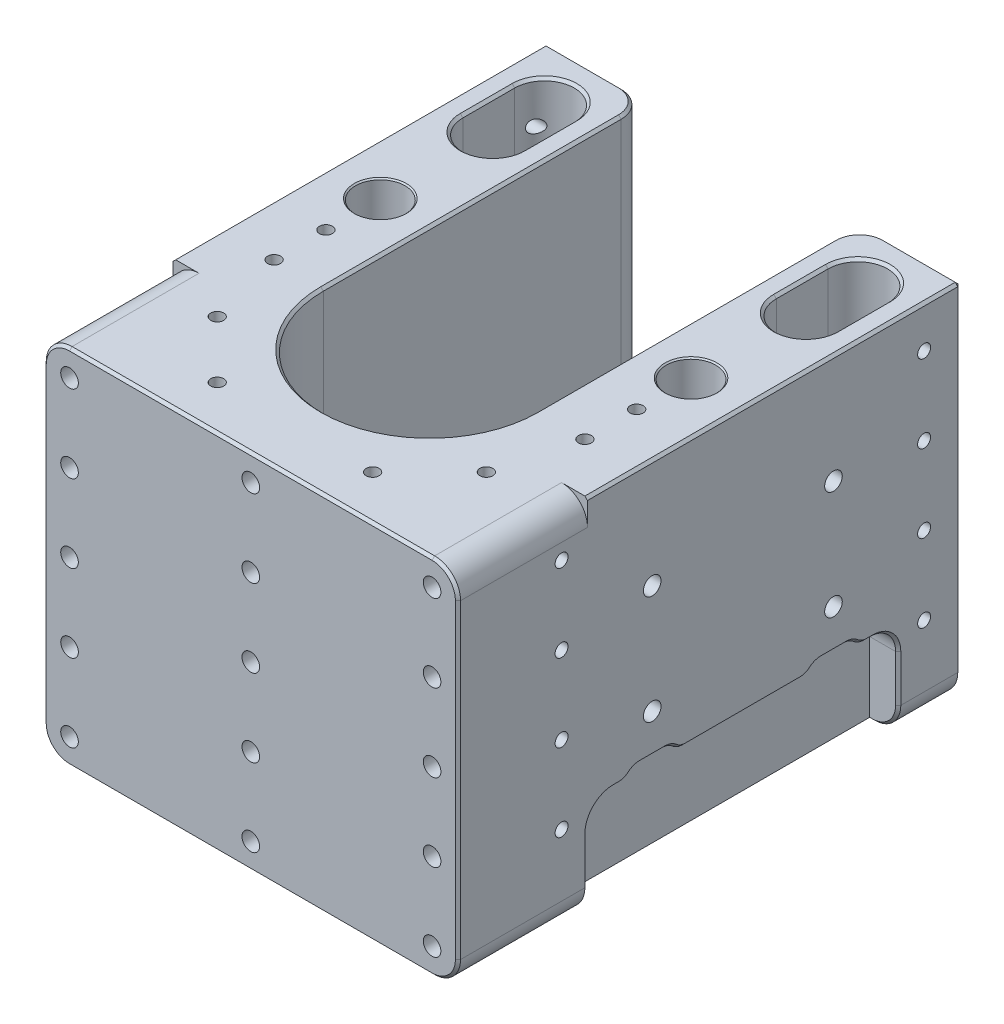
from build123d import *

# Parameters (mm, degrees)
BOSS_EXTRUDE1_DEPTH              = 140
SKETCH3_R                        = 9.55
CUT_EXTRUDE2_DEPTH               = 14.326
M8X1_25_TAPPED_HOLE1_AT_2_COUNT  = 2
M8X1_25_TAPPED_HOLE1_AT_2_PITCH  = 70
M8X1_25_TAPPED_HOLE1_AT_3_COUNT  = 2
M8X1_25_TAPPED_HOLE1_AT_3_PITCH  = 81.633326528
M8X1_25_TAPPED_HOLE1_AT_4_COUNT  = 2
M8X1_25_TAPPED_HOLE1_AT_4_PITCH  = 42
FILLET1_R                        = 10
SKETCH36_W                       = 33.761991249
SKETCH36_H                       = 120
SKETCH36_W_2                     = 53.52949171
CUT_EXTRUDE3_DEPTH               = 38
CBORE_FOR_M8_SHCS1_D             = 9
CBORE_FOR_M8_SHCS1_CBORE_D       = 15
CBORE_FOR_M8_SHCS1_CBORE_DEPTH   = 9
CHAMFER7_SIZE                    = 0.5
CHAMFER11_SIZE                   = 1
CHAMFER12_SIZE                   = 0.5
M8X1_25_TAPPED_HOLE3_D           = 6.8
M8X1_25_TAPPED_HOLE3_DEPTH       = 20
M8X1_25_TAPPED_HOLE3_CSINK_D     = 8.6
M8X1_25_TAPPED_HOLE3_CSINK_ANGLE = 90
M8X1_25_TAPPED_HOLE3_TIP         = 2.042926105
M6X1_0_TAPPED_HOLE1_D            = 5
M6X1_0_TAPPED_HOLE1_DEPTH        = 15
M6X1_0_TAPPED_HOLE1_CSINK_D      = 6.05
M6X1_0_TAPPED_HOLE1_CSINK_ANGLE  = 90
M6X1_0_TAPPED_HOLE1_TIP          = 1.502151548
CUT_EXTRUDE4_DEPTH               = 25
FILLET2_R                        = 10
CUT_EXTRUDE5_DEPTH               = 50
FILLET3_R                        = 10
CHAMFER3_SIZE                    = 1
CHAMFER15_SIZE                   = 1
SKETCH55_W                       = 20
SKETCH55_H                       = 3
CUT_EXTRUDE6_DEPTH               = 227.296265988
FILLET4_R                        = 6
FILLET5_R                        = 6
CHAMFER16_SIZE                   = 1
M8X1_25_TAPPED_HOLE4_D           = 6.8
M8X1_25_TAPPED_HOLE4_DEPTH       = 20
M8X1_25_TAPPED_HOLE4_TIP         = 2.042926105
M6X1_0_TAPPED_HOLE2_D            = 5
M6X1_0_TAPPED_HOLE2_DEPTH        = 17
M6X1_0_TAPPED_HOLE2_TIP          = 1.502151548
M6X1_0_TAPPED_HOLE3_AT_2_COUNT   = 2
M6X1_0_TAPPED_HOLE3_AT_2_PITCH   = 30
M6X1_0_TAPPED_HOLE3_AT_3_COUNT   = 2
M6X1_0_TAPPED_HOLE3_AT_3_PITCH   = 60
M6X1_0_TAPPED_HOLE3_AT_4_COUNT   = 2
M6X1_0_TAPPED_HOLE3_AT_4_PITCH   = 90
M6X1_0_TAPPED_HOLE3_AT_5_COUNT   = 2
M6X1_0_TAPPED_HOLE3_AT_5_PITCH   = 140
M6X1_0_TAPPED_HOLE3_AT_6_COUNT   = 2
M6X1_0_TAPPED_HOLE3_AT_6_PITCH   = 143.178210633
M6X1_0_TAPPED_HOLE3_AT_7_COUNT   = 2
M6X1_0_TAPPED_HOLE3_AT_7_PITCH   = 152.315462117
M6X1_0_TAPPED_HOLE3_AT_8_COUNT   = 2
M6X1_0_TAPPED_HOLE3_AT_8_PITCH   = 166.433169771


with BuildPart() as part:
    # Sketch1 → Boss-Extrude1 (new body)
    with BuildSketch(Plane(origin=(0, 0, 0), x_dir=(1, 0, 0), z_dir=(0, 1, 0))):
        with BuildLine():
            Line((41, 97), (80, 97))
            Line((80, 97), (80, -97))
            Line((80, -97), (-80, -97))
            Line((-80, -97), (-80, 97))
            Line((-80, 97), (-41, 97))
            Line((-41, 97), (-41, -28))
            ThreePointArc((-41, -28), (0, -69), (41, -28))
            Line((41, -28), (41, 97))
        make_face()
    extrude(amount=BOSS_EXTRUDE1_DEPTH)

    # Sketch3 → Cut-Extrude2 (cut)
    with BuildSketch(Plane(origin=(0, 140, 0), x_dir=(1, 0, 0), z_dir=(0, 1, 0))):
        with Locations(Location((-60, 13, 0), (0, 0, 270))):
            Circle(SKETCH3_R)
        with Locations(Location((60, 13, 0), (0, 0, 270))):
            Circle(SKETCH3_R)
    extrude(amount=-CUT_EXTRUDE2_DEPTH, mode=Mode.SUBTRACT)

    # Sketch10 → M8x1.25 Tapped Hole1 (revolve, cut)
    with BuildSketch(Plane(origin=(80, 56, -48), x_dir=(0, 0, -1), z_dir=(0, 1, 0))):
        Polygon((0, 0), (0, 32.042926105), (3.4, 30), (3.4, 0), align=None)
    m8x1_25_tapped_hole1 = revolve(axis=Axis((86.35, 56, -48), (-1, 0, 0)), mode=Mode.SUBTRACT)

    # M8x1.25 Tapped Hole1 at 2: M8x1.25 Tapped Hole1 ×2
    with Locations(*[(0, 0, i * M8X1_25_TAPPED_HOLE1_AT_2_PITCH) for i in range(1, M8X1_25_TAPPED_HOLE1_AT_2_COUNT)]):
        add(m8x1_25_tapped_hole1, mode=Mode.SUBTRACT)

    # M8x1.25 Tapped Hole1 at 3: M8x1.25 Tapped Hole1 ×2
    with Locations(*[Vector(0, 0.5144957554275263, 0.8574929257125443) * (i * M8X1_25_TAPPED_HOLE1_AT_3_PITCH) for i in range(1, M8X1_25_TAPPED_HOLE1_AT_3_COUNT)]):
        add(m8x1_25_tapped_hole1, mode=Mode.SUBTRACT)

    # M8x1.25 Tapped Hole1 at 4: M8x1.25 Tapped Hole1 ×2
    with Locations(*[(0, i * M8X1_25_TAPPED_HOLE1_AT_4_PITCH, 0) for i in range(1, M8X1_25_TAPPED_HOLE1_AT_4_COUNT)]):
        add(m8x1_25_tapped_hole1, mode=Mode.SUBTRACT)

    # Mirror2: M8x1.25 Tapped Hole1 across plane
    add(m8x1_25_tapped_hole1.mirror(Plane(origin=(0, 0, 0), x_dir=(0, 0, 1), z_dir=(1, 0, 0))), mode=Mode.SUBTRACT)

    # Mirror2 copy 1 sketch → Mirror2 copy 1 (revolve, cut)
    with BuildSketch(Plane(origin=(-80, 56, 22), x_dir=(0, 0, -1), z_dir=(0, 1, 0))):
        Polygon((0, 0), (0, -32.042926105), (3.4, -30), (3.4, 0), align=None)
    revolve(axis=Axis((-86.35, 56, 22), (-1, 0, 0)), mode=Mode.SUBTRACT)

    # Mirror2 copy 2 sketch → Mirror2 copy 2 (revolve, cut)
    with BuildSketch(Plane(origin=(-80, 98, 22), x_dir=(0, 0, -1), z_dir=(0, 1, 0))):
        Polygon((0, 0), (0, -32.042926105), (3.4, -30), (3.4, 0), align=None)
    revolve(axis=Axis((-86.35, 98, 22), (-1, 0, 0)), mode=Mode.SUBTRACT)

    # Mirror2 copy 3 sketch → Mirror2 copy 3 (revolve, cut)
    with BuildSketch(Plane(origin=(-80, 98, -48), x_dir=(0, 0, -1), z_dir=(0, 1, 0))):
        Polygon((0, 0), (0, -32.042926105), (3.4, -30), (3.4, 0), align=None)
    revolve(axis=Axis((-86.35, 98, -48), (-1, 0, 0)), mode=Mode.SUBTRACT)

    # Fillet1
    fillet1_edges = [part.edges().sort_by_distance(p)[0] for p in [
        (-41, 70, -97),
        (41, 70, -97),
    ]]
    fillet(fillet1_edges, radius=FILLET1_R)

    # Sketch36 → Cut-Extrude3 (cut)
    with BuildSketch(Plane(origin=(0, 0, 0), x_dir=(1, 0, 0), z_dir=(0, 1, 0))):
        with Locations((-85.880995625, 13)):
            Rectangle(SKETCH36_W, SKETCH36_H)
        with Locations((95.764745855, 13)):
            Rectangle(SKETCH36_W_2, SKETCH36_H)
    extrude(amount=CUT_EXTRUDE3_DEPTH, mode=Mode.SUBTRACT)

    # CBORE for M8 SHCS1 (through all)
    with Locations(Plane(origin=(0, 0, 0), x_dir=(-1, 0, 0), z_dir=(0, -1, 0))):
        with Locations((60, 13), (-60, 13)):
            CounterBoreHole(CBORE_FOR_M8_SHCS1_D / 2, CBORE_FOR_M8_SHCS1_CBORE_D / 2, CBORE_FOR_M8_SHCS1_CBORE_DEPTH)

    # Chamfer7
    chamfer7_edges = [part.edges().sort_by_distance(p)[0] for p in [
        (-60, 140, -22.55),
        (60, 140, -22.55),
    ]]
    chamfer(chamfer7_edges, length=CHAMFER7_SIZE)

    # Chamfer11
    chamfer11_edges = [part.edges().sort_by_distance(p)[0] for p in [
        (67.5, 0, -13),
        (-52.5, 0, -13),
    ]]
    chamfer(chamfer11_edges, length=CHAMFER11_SIZE)

    # Chamfer12
    chamfer12_edges = [part.edges().sort_by_distance(p)[0] for p in [
        (55.5, 125.674, -13),
        (55.5, 9, -13),
        (-64.5, 125.674, -13),
        (-64.5, 9, -13),
    ]]
    chamfer(chamfer12_edges, length=CHAMFER12_SIZE)

    # M8x1.25 Tapped Hole3
    with Locations(Plane(origin=(0, 0, 0), x_dir=(-1, 0, 0), z_dir=(0, -1, 0))):
        with Locations((54, 57.5), (54, 27.5), (54, -2.5), (54, -32.5), (-54, 57.5), (-54, 27.5), (-54, -2.5), (-54, -32.5), (-54, -62.5), (54, -62.5)):
            CounterSinkHole(M8X1_25_TAPPED_HOLE3_D / 2, M8X1_25_TAPPED_HOLE3_CSINK_D / 2, depth=M8X1_25_TAPPED_HOLE3_DEPTH, counter_sink_angle=M8X1_25_TAPPED_HOLE3_CSINK_ANGLE)
            with Locations((0, 0, -(M8X1_25_TAPPED_HOLE3_DEPTH + M8X1_25_TAPPED_HOLE3_TIP / 2))):  # 118° drill point
                Cone(0, M8X1_25_TAPPED_HOLE3_D / 2, M8X1_25_TAPPED_HOLE3_TIP, mode=Mode.SUBTRACT)

    # M6x1.0 Tapped Hole1
    with Locations(Plane(origin=(0, 0, 0), x_dir=(-1, 0, 0), z_dir=(0, -1, 0))):
        with Locations((-60, -85), (-20, -85), (20, -85), (60, -85)):
            CounterSinkHole(M6X1_0_TAPPED_HOLE1_D / 2, M6X1_0_TAPPED_HOLE1_CSINK_D / 2, depth=M6X1_0_TAPPED_HOLE1_DEPTH, counter_sink_angle=M6X1_0_TAPPED_HOLE1_CSINK_ANGLE)
            with Locations((0, 0, -(M6X1_0_TAPPED_HOLE1_DEPTH + M6X1_0_TAPPED_HOLE1_TIP / 2))):  # 118° drill point
                Cone(0, M6X1_0_TAPPED_HOLE1_D / 2, M6X1_0_TAPPED_HOLE1_TIP, mode=Mode.SUBTRACT)

    # Sketch45 → Cut-Extrude4 (cut)
    with BuildSketch(Plane(origin=(0, 140, 0), x_dir=(1, 0, 0), z_dir=(0, 1, 0))):
        with BuildLine():
            Line((-72, 56.905108067), (-72, 76.905108067))
            ThreePointArc((-72, 76.905108067), (-60.5, 88.405108067), (-49, 76.905108067))
            Line((-49, 76.905108067), (-49, 56.905108067))
            ThreePointArc((-49, 56.905108067), (-60.5, 45.405108067), (-72, 56.905108067))
        make_face()
    cut_extrude4 = extrude(amount=-CUT_EXTRUDE4_DEPTH, mode=Mode.SUBTRACT)

    # Mirror3: Cut-Extrude4 across plane
    add(cut_extrude4.mirror(Plane(origin=(0, 0, 0), x_dir=(0, 0, 1), z_dir=(1, 0, 0))), mode=Mode.SUBTRACT)

    # Fillet2
    fillet2_edges = [part.edges().sort_by_distance(p)[0] for p in [
        (74.5, 38, -73),
        (74.5, 38, 47),
        (-74.5, 38, -73),
        (-74.5, 38, 47),
    ]]
    fillet(fillet2_edges, radius=FILLET2_R)

    # Sketch46 → Cut-Extrude5 (cut)
    with BuildSketch(Plane.XY.offset(97)):
        with BuildLine():
            Line((70, 140), (80, 140))
            Line((80, 140), (80, 130))
            ThreePointArc((80, 130), (77.071067812, 137.071067812), (70, 140))
        make_face()
    cut_extrude5 = extrude(amount=-CUT_EXTRUDE5_DEPTH, mode=Mode.SUBTRACT)

    # Mirror4: Cut-Extrude5 across plane
    add(cut_extrude5.mirror(Plane(origin=(0, 0, 0), x_dir=(0, 0, 1), z_dir=(1, 0, 0))), mode=Mode.SUBTRACT)

    # Fillet3
    fillet3_edges = [part.edges().sort_by_distance(p)[0] for p in [
        (80, 0, 72),
        (80, 0, -85),
        (-80, 0, 72),
        (-80, 0, -85),
    ]]
    fillet(fillet3_edges, radius=FILLET3_R)

    # Chamfer3
    chamfer3_edges = [part.edges().sort_by_distance(p)[0] for p in [
        (0, 0, 69),
        (-80, 75, -97),
        (80, 75, -97),
        (0, 140, 69),
        (-41, 140, -29.5),
        (-80, 140, -25),
        (80, 70, 97),
        (80, 140, -25),
        (77.071067812, 137.071067812, 97),
        (0, 140, 97),
        (-80, 70, 97),
        (-77.071067812, 137.071067812, 97),
        (60.5, 0, -97),
        (0, 0, 97),
        (-77.071067812, 2.928932188, -97),
        (77.071067812, 2.928932188, -97),
        (-77.071067812, 2.928932188, 97),
        (77.071067812, 2.928932188, 97),
        (41, 0, -29.5),
        (41, 140, -29.5),
        (-60.5, 0, -97),
        (-43.928932188, 0, -94.071067812),
        (43.928932188, 0, -94.071067812),
        (-65.5, 140, -97),
        (-43.928932188, 140, -94.071067812),
        (43.928932188, 140, -94.071067812),
        (65.5, 140, -97),
        (-41, 0, -29.5),
    ]]
    chamfer(chamfer3_edges, length=CHAMFER3_SIZE)

    # Chamfer15
    chamfer15_edges = [part.edges().sort_by_distance(p)[0] for p in [
        (-60.5, 140, -45.405108067),
        (-49, 140, -66.905108067),
        (-60.5, 140, -88.405108067),
        (-72, 140, -66.905108067),
        (60.5, 140, -45.405108067),
        (49, 140, -66.905108067),
        (60.5, 140, -88.405108067),
        (72, 140, -66.905108067),
    ]]
    chamfer(chamfer15_edges, length=CHAMFER15_SIZE)

    # Sketch55 → Cut-Extrude6 (cut, through all)
    with BuildSketch(Plane(origin=(69, 0, 0), x_dir=(0, 0, -1), z_dir=(1, 0, 0))):
        with Locations((-22, 39.5)):
            Rectangle(SKETCH55_W, SKETCH55_H)
        with Locations((48, 39.5)):
            Rectangle(SKETCH55_W, SKETCH55_H)
    cut_extrude6 = extrude(amount=CUT_EXTRUDE6_DEPTH, mode=Mode.SUBTRACT)

    # Mirror6: Cut-Extrude6 across plane
    add(cut_extrude6.mirror(Plane(origin=(0, 0, 0), x_dir=(0, 0, 1), z_dir=(1, 0, 0))), mode=Mode.SUBTRACT)

    # Fillet4
    # the kernel refuses this fillet: 6 mm, written as the material it adds along each edge
    with BuildSketch(Plane(origin=(56.009618943, 41, -58), x_dir=(0, -1, 0), z_dir=(1, 0, 0)), Plane(origin=(56.009618943, 41, 12), x_dir=(0, -1, 0), z_dir=(1, 0, 0)), Plane(origin=(-56.009618943, 41, -38), x_dir=(0, -1, 0), z_dir=(-1, 0, 0)), Plane(origin=(-56.009618943, 41, 32), x_dir=(0, -1, 0), z_dir=(-1, 0, 0))) as fillet4_piece_1:
        with BuildLine():
            CenterArc((6, -5.196152423), FILLET4_R, 120, 60)
            Line((0, -5.196152423), (-0.12, -5.196152423))
            Line((-0.12, -5.196152423), (-0.12, 0))
            Line((-0.12, 0), (0, 0.12))
            ThreePointArc((0, 0.12), (1.5, 0.12), (2.94, 0.103923048))
            Line((2.94, 0.103923048), (3, 0))
        make_face()
    extrude(amount=23.990381057)
    with BuildSketch(Plane(origin=(56.009618943, 41, -38), x_dir=(0, 0, -1), z_dir=(1, 0, 0)), Plane(origin=(56.009618943, 41, 32), x_dir=(0, 0, -1), z_dir=(1, 0, 0)), Plane(origin=(-56.009618943, 41, -58), x_dir=(0, 0, 1), z_dir=(-1, 0, 0)), Plane(origin=(-56.009618943, 41, 12), x_dir=(0, 0, 1), z_dir=(-1, 0, 0))) as fillet4_piece_2:
        with BuildLine():
            CenterArc((5.196152423, -6), FILLET4_R, 90, 60)
            Line((0, -3), (-0.103923048, -2.94))
            ThreePointArc((-0.103923048, -2.94), (-0.12, -1.5), (-0.12, 0))
            Line((-0.12, 0), (0, 0.12))
            Line((0, 0.12), (5.196152423, 0.12))
            Line((5.196152423, 0.12), (5.196152423, 0))
        make_face()
    extrude(amount=23.990381057)

    # Fillet5
    fillet5_edges = [part.edges().sort_by_distance(p)[0] for p in [
        (74.5, 38, 32),
        (74.5, 38, 12),
        (74.5, 38, -38),
        (74.5, 38, -58),
        (-74.5, 38, 12),
        (-74.5, 38, 32),
        (-74.5, 38, -58),
        (-74.5, 38, -38),
    ]]
    fillet(fillet5_edges, radius=FILLET5_R)

    # Chamfer16
    # the kernel refuses this chamfer: 1 mm, written as the material it takes off along each edge
    with BuildSketch(Plane(origin=(69, 0, 47), x_dir=(0, 0.9996219169112968, -0.027495876610589075), z_dir=(1, 0, 0)), Plane(origin=(70, 0, -73), x_dir=(0, 0.999621916911297, 0.02749587661058218), z_dir=(-1, 0, 0)), Plane(origin=(-69, 0, 47), x_dir=(0, -0.027495876610586292, 0.9996219169112968), z_dir=(-1, 0, 0)), Plane(origin=(-70, 0, -73), x_dir=(0, -0.027495876610586483, -0.9996219169112968), z_dir=(1, 0, 0))) as chamfer16_piece_1:
        Polygon((CHAMFER16_SIZE * 0.999621916911, CHAMFER16_SIZE * 0.0274958766106), (-CHAMFER16_SIZE * 0.0274958766106, CHAMFER16_SIZE * 0.999621916911), (0, 0), align=None)
    extrude(amount=1, mode=Mode.SUBTRACT)
    with BuildSketch(Plane(origin=(69, 0, -73), x_dir=(0.027495876610582174, 0.9996219169112968, 0), z_dir=(0, 0, 1)), Plane(origin=(-69, 0, -73), x_dir=(0.9996219169112968, -0.027495876610586483, 0), z_dir=(0, 0, 1))) as chamfer16_piece_2:
        Polygon((CHAMFER16_SIZE * 0.999621916911, CHAMFER16_SIZE * 0.0274958766106), (-CHAMFER16_SIZE * 0.0274958766106, CHAMFER16_SIZE * 0.999621916911), (0, 0), align=None)
    extrude(amount=120, mode=Mode.SUBTRACT)
    with BuildSketch(Plane(origin=(80, 10, 47), x_dir=(0.027495876610582105, 0, 0.999621916911297), z_dir=(0, 1, 0)), Plane(origin=(-80, 28, -73), x_dir=(0.999621916911297, 0, 0.027495876610582292), z_dir=(0, -1, 0)), Plane(origin=(-80, 10, 47), x_dir=(0.9996219169112968, 0, -0.027495876610589196), z_dir=(0, 1, 0)), Plane(origin=(80, 28, -73), x_dir=(0.02749587661058229, 0, -0.9996219169112968), z_dir=(0, -1, 0))) as chamfer16_piece_3:
        Polygon((CHAMFER16_SIZE * 0.999621916911, -CHAMFER16_SIZE * 0.0274958766106), (-CHAMFER16_SIZE * 0.0274958766106, -CHAMFER16_SIZE * 0.999621916911), (0, 0), align=None)
    extrude(amount=18, mode=Mode.SUBTRACT)
    with BuildSketch(Plane(origin=(80, 38, -63), x_dir=(0.027495876610582105, 0.999621916911297, 0), z_dir=(0, 0, 1)), Plane(origin=(80, 38, 34.74110151), x_dir=(0.027495876610582105, 0.999621916911297, 0), z_dir=(0, 0, 1))) as chamfer16_piece_4:
        Polygon((CHAMFER16_SIZE * 0.999621916911, CHAMFER16_SIZE * 0.0274958766106), (-CHAMFER16_SIZE * 0.0274958766106, CHAMFER16_SIZE * 0.999621916911), (0, 0), align=None)
    extrude(amount=2.25889849, mode=Mode.SUBTRACT)
    with BuildSketch(Plane(origin=(-80, 38, -63), x_dir=(-0.027495876610582105, 0.999621916911297, 0), z_dir=(0, 0, 1)), Plane(origin=(-80, 38, 34.74110151), x_dir=(-0.027495876610582105, 0.999621916911297, 0), z_dir=(0, 0, 1))) as chamfer16_piece_5:
        Polygon((CHAMFER16_SIZE * 0.999621916911, -CHAMFER16_SIZE * 0.0274958766106), (-CHAMFER16_SIZE * 0.0274958766106, -CHAMFER16_SIZE * 0.999621916911), (0, 0), align=None)
    extrude(amount=2.25889849, mode=Mode.SUBTRACT)
    with BuildSketch(Plane(origin=(80, 28, 37), x_dir=(0, 0, 1), z_dir=(0, -1, 0))) as chamfer16_piece_6:
        Polygon((10 + CHAMFER16_SIZE, 0), (10, CHAMFER16_SIZE), (10, 0), align=None)
    revolve(axis=Axis((80, 28, 37), (-1, 0, 0)), revolution_arc=90, mode=Mode.SUBTRACT)
    with BuildSketch(Plane(origin=(80, 28, -63), x_dir=(0, 0, -1), z_dir=(0, -1, 0))) as chamfer16_piece_7:
        Polygon((10 + CHAMFER16_SIZE, 0), (10, -CHAMFER16_SIZE), (10, 0), align=None)
    revolve(axis=Axis((80, 28, -63), (1, 0, 0)), revolution_arc=90, mode=Mode.SUBTRACT)
    with BuildSketch(Plane(origin=(-80, 28, 37), x_dir=(0, 0, 1), z_dir=(0, -1, 0))) as chamfer16_piece_8:
        Polygon((10 + CHAMFER16_SIZE, 0), (10, -CHAMFER16_SIZE), (10, 0), align=None)
    revolve(axis=Axis((-80, 28, 37), (-1, 0, 0)), revolution_arc=90, mode=Mode.SUBTRACT)
    with BuildSketch(Plane(origin=(-80, 28, -63), x_dir=(0, 0, -1), z_dir=(0, -1, 0))) as chamfer16_piece_9:
        Polygon((10 + CHAMFER16_SIZE, 0), (10, CHAMFER16_SIZE), (10, 0), align=None)
    revolve(axis=Axis((-80, 28, -63), (1, 0, 0)), revolution_arc=90, mode=Mode.SUBTRACT)
    with BuildSketch(Plane(origin=(-70, 10, -73), x_dir=(0, -1, 0), z_dir=(1, 0, 0))) as chamfer16_piece_10:
        Polygon((10, CHAMFER16_SIZE), (10 - CHAMFER16_SIZE, 0), (10, 0), align=None)
    revolve(axis=Axis((-70, 10, -73), (0, 0, -1)), revolution_arc=90, mode=Mode.SUBTRACT)
    with BuildSketch(Plane(origin=(70, 10, -73), x_dir=(1, 0, 0), z_dir=(0, 1, 0))) as chamfer16_piece_11:
        Polygon((10 - CHAMFER16_SIZE, 0), (10, CHAMFER16_SIZE), (10, 0), align=None)
    revolve(axis=Axis((70, 10, -73), (0, 0, -1)), revolution_arc=90, mode=Mode.SUBTRACT)
    with BuildSketch(Plane(origin=(70, 10, 47), x_dir=(1, 0, 0), z_dir=(0, 1, 0))) as chamfer16_piece_12:
        Polygon((10 - CHAMFER16_SIZE, 0), (10, -CHAMFER16_SIZE), (10, 0), align=None)
    revolve(axis=Axis((70, 10, 47), (0, 0, -1)), revolution_arc=90, mode=Mode.SUBTRACT)
    with BuildSketch(Plane(origin=(-70, 10, 47), x_dir=(0, -1, 0), z_dir=(1, 0, 0))) as chamfer16_piece_13:
        Polygon((10, -CHAMFER16_SIZE), (10 - CHAMFER16_SIZE, 0), (10, 0), align=None)
    revolve(axis=Axis((-70, 10, 47), (0, 0, -1)), revolution_arc=90, mode=Mode.SUBTRACT)
    with BuildSketch(Plane(origin=(-80, 41, -43.196152423), x_dir=(-0.027495876610582105, 0.999621916911297, 0), z_dir=(0, 0, -1)), Plane(origin=(-80, 41, 26.803847577), x_dir=(-0.027495876610582105, 0.999621916911297, 0), z_dir=(0, 0, -1))) as chamfer16_piece_14:
        Polygon((CHAMFER16_SIZE * 0.999621916911, CHAMFER16_SIZE * 0.0274958766106), (-CHAMFER16_SIZE * 0.0274958766106, CHAMFER16_SIZE * 0.999621916911), (0, 0), align=None)
    extrude(amount=9.607695155, mode=Mode.SUBTRACT)
    with BuildSketch(Plane(origin=(80, 41, -43.196152423), x_dir=(0.027495876610582105, 0.999621916911297, 0), z_dir=(0, 0, -1)), Plane(origin=(80, 41, 26.803847577), x_dir=(0.027495876610582105, 0.999621916911297, 0), z_dir=(0, 0, -1))) as chamfer16_piece_15:
        Polygon((CHAMFER16_SIZE * 0.999621916911, -CHAMFER16_SIZE * 0.0274958766106), (-CHAMFER16_SIZE * 0.0274958766106, -CHAMFER16_SIZE * 0.999621916911), (0, 0), align=None)
    extrude(amount=9.607695155, mode=Mode.SUBTRACT)
    with BuildSketch(Plane(origin=(-80, 35, -43.196152423), x_dir=(0, 0.7499999999999988, 0.6614378277661489), z_dir=(0, -0.6614378277661489, 0.7499999999999988))) as chamfer16_piece_16:
        Polygon((6 + CHAMFER16_SIZE, 0), (6, -CHAMFER16_SIZE), (6, 0), align=None)
    revolve(axis=Axis((-80, 35, -43.196152423), (-1, 0, 0)), revolution_arc=41.409622109, mode=Mode.SUBTRACT)
    with BuildSketch(Plane(origin=(-80, 35, 26.803847577), x_dir=(0, 0.7499999999999997, 0.661437827766148), z_dir=(0, -0.661437827766148, 0.7499999999999997))) as chamfer16_piece_17:
        Polygon((6 + CHAMFER16_SIZE, 0), (6, -CHAMFER16_SIZE), (6, 0), align=None)
    revolve(axis=Axis((-80, 35, 26.803847577), (-1, 0, 0)), revolution_arc=41.409622109, mode=Mode.SUBTRACT)
    with BuildSketch(Plane(origin=(80, 35, -52.803847577), x_dir=(0, 0.7499999999999999, -0.6614378277661477), z_dir=(0, -0.6614378277661477, -0.7499999999999999))) as chamfer16_piece_18:
        Polygon((6 + CHAMFER16_SIZE, 0), (6, -CHAMFER16_SIZE), (6, 0), align=None)
    revolve(axis=Axis((80, 35, -52.803847577), (1, 0, 0)), revolution_arc=41.409622109, mode=Mode.SUBTRACT)
    with BuildSketch(Plane(origin=(80, 35, 17.196152423), x_dir=(0, 0.7499999999999997, -0.661437827766148), z_dir=(0, -0.661437827766148, -0.7499999999999997))) as chamfer16_piece_19:
        Polygon((6 + CHAMFER16_SIZE, 0), (6, -CHAMFER16_SIZE), (6, 0), align=None)
    revolve(axis=Axis((80, 35, 17.196152423), (1, 0, 0)), revolution_arc=41.409622109, mode=Mode.SUBTRACT)
    with BuildSketch(Plane(origin=(-80, 35, -52.803847577), x_dir=(0, 1, 0), z_dir=(0, 0, 1))) as chamfer16_piece_20:
        Polygon((6 + CHAMFER16_SIZE, 0), (6, -CHAMFER16_SIZE), (6, 0), align=None)
    revolve(axis=Axis((-80, 35, -52.803847577), (-1, 0, 0)), revolution_arc=41.409622109, mode=Mode.SUBTRACT)
    with BuildSketch(Plane(origin=(-80, 38, -35.25889849), x_dir=(-0.027495876610582105, 0.999621916911297, 0), z_dir=(0, 0, 1))) as chamfer16_piece_21:
        Polygon((CHAMFER16_SIZE * 0.999621916911, -CHAMFER16_SIZE * 0.0274958766106), (-CHAMFER16_SIZE * 0.0274958766106, -CHAMFER16_SIZE * 0.999621916911), (0, 0), align=None)
    extrude(amount=44.517796979, mode=Mode.SUBTRACT)
    with BuildSketch(Plane(origin=(-80, 35, 17.196152423), x_dir=(0, 1, 0), z_dir=(0, 0, 1))) as chamfer16_piece_22:
        Polygon((6 + CHAMFER16_SIZE, 0), (6, -CHAMFER16_SIZE), (6, 0), align=None)
    revolve(axis=Axis((-80, 35, 17.196152423), (-1, 0, 0)), revolution_arc=41.409622109, mode=Mode.SUBTRACT)
    with BuildSketch(Plane(origin=(-80, 44, 34.74110151), x_dir=(0, -1, 0), z_dir=(0, 0, 1))) as chamfer16_piece_23:
        Polygon((6 - CHAMFER16_SIZE, 0), (6, CHAMFER16_SIZE), (6, 0), align=None)
    revolve(axis=Axis((-80, 44, 34.74110151), (1, 0, 0)), revolution_arc=41.409622109, mode=Mode.SUBTRACT)
    with BuildSketch(Plane(origin=(-80, 44, 9.25889849), x_dir=(0, -0.7499999999999999, 0.6614378277661477), z_dir=(0, 0.6614378277661477, 0.7499999999999999))) as chamfer16_piece_24:
        Polygon((6 - CHAMFER16_SIZE, 0), (6, CHAMFER16_SIZE), (6, 0), align=None)
    revolve(axis=Axis((-80, 44, 9.25889849), (1, 0, 0)), revolution_arc=41.409622109, mode=Mode.SUBTRACT)
    with BuildSketch(Plane(origin=(-80, 44, -35.25889849), x_dir=(0, -1, 0), z_dir=(0, 0, 1))) as chamfer16_piece_25:
        Polygon((6 - CHAMFER16_SIZE, 0), (6, CHAMFER16_SIZE), (6, 0), align=None)
    revolve(axis=Axis((-80, 44, -35.25889849), (1, 0, 0)), revolution_arc=41.409622109, mode=Mode.SUBTRACT)
    with BuildSketch(Plane(origin=(-80, 44, -60.74110151), x_dir=(0, -0.7499999999999993, 0.6614378277661483), z_dir=(0, 0.6614378277661483, 0.7499999999999993))) as chamfer16_piece_26:
        Polygon((6 - CHAMFER16_SIZE, 0), (6, CHAMFER16_SIZE), (6, 0), align=None)
    revolve(axis=Axis((-80, 44, -60.74110151), (1, 0, 0)), revolution_arc=41.409622109, mode=Mode.SUBTRACT)
    with BuildSketch(Plane(origin=(80, 38, -35.25889849), x_dir=(0.027495876610582105, 0.999621916911297, 0), z_dir=(0, 0, 1))) as chamfer16_piece_27:
        Polygon((CHAMFER16_SIZE * 0.999621916911, CHAMFER16_SIZE * 0.0274958766106), (-CHAMFER16_SIZE * 0.0274958766106, CHAMFER16_SIZE * 0.999621916911), (0, 0), align=None)
    extrude(amount=44.517796979, mode=Mode.SUBTRACT)
    with BuildSketch(Plane(origin=(80, 35, -43.196152423), x_dir=(0, 1, 0), z_dir=(0, 0, -1))) as chamfer16_piece_28:
        Polygon((6 + CHAMFER16_SIZE, 0), (6, -CHAMFER16_SIZE), (6, 0), align=None)
    revolve(axis=Axis((80, 35, -43.196152423), (1, 0, 0)), revolution_arc=41.409622109, mode=Mode.SUBTRACT)
    with BuildSketch(Plane(origin=(80, 35, 26.803847577), x_dir=(0, 1, 0), z_dir=(0, 0, -1))) as chamfer16_piece_29:
        Polygon((6 + CHAMFER16_SIZE, 0), (6, -CHAMFER16_SIZE), (6, 0), align=None)
    revolve(axis=Axis((80, 35, 26.803847577), (1, 0, 0)), revolution_arc=41.409622109, mode=Mode.SUBTRACT)
    with BuildSketch(Plane(origin=(80, 44, 34.74110151), x_dir=(0, -1, 0), z_dir=(0, 0, 1))) as chamfer16_piece_30:
        Polygon((6 - CHAMFER16_SIZE, 0), (6, -CHAMFER16_SIZE), (6, 0), align=None)
    revolve(axis=Axis((80, 44, 34.74110151), (1, 0, 0)), revolution_arc=41.409622109, mode=Mode.SUBTRACT)
    with BuildSketch(Plane(origin=(80, 44, 9.25889849), x_dir=(0, -1, 0), z_dir=(0, 0, -1))) as chamfer16_piece_31:
        Polygon((6 - CHAMFER16_SIZE, 0), (6, CHAMFER16_SIZE), (6, 0), align=None)
    revolve(axis=Axis((80, 44, 9.25889849), (-1, 0, 0)), revolution_arc=41.409622109, mode=Mode.SUBTRACT)
    with BuildSketch(Plane(origin=(80, 44, -35.25889849), x_dir=(0, -0.7499999999999999, -0.6614378277661477), z_dir=(0, 0.6614378277661477, -0.7499999999999999))) as chamfer16_piece_32:
        Polygon((6 - CHAMFER16_SIZE, 0), (6, CHAMFER16_SIZE), (6, 0), align=None)
    revolve(axis=Axis((80, 44, -35.25889849), (-1, 0, 0)), revolution_arc=41.409622109, mode=Mode.SUBTRACT)
    with BuildSketch(Plane(origin=(80, 44, -60.74110151), x_dir=(0, -0.7499999999999999, 0.6614378277661477), z_dir=(0, 0.6614378277661477, 0.7499999999999999))) as chamfer16_piece_33:
        Polygon((6 - CHAMFER16_SIZE, 0), (6, -CHAMFER16_SIZE), (6, 0), align=None)
    revolve(axis=Axis((80, 44, -60.74110151), (1, 0, 0)), revolution_arc=41.409622109, mode=Mode.SUBTRACT)
    with BuildSketch(Plane(origin=(66.428317012, 0, 47), x_dir=(0, 0.9996219169112968, -0.027495876610589075), z_dir=(1, 0, 0))) as chamfer16_piece_34a_section:
        Polygon((CHAMFER16_SIZE * 0.999621916911, CHAMFER16_SIZE * 0.0274958766106), (-CHAMFER16_SIZE * 0.0274958766106, CHAMFER16_SIZE * 0.999621916911), (0, 0), align=None)
    chamfer16_piece_34a = extrude(amount=3.571682988, mode=Mode.PRIVATE)
    chamfer16_piece_34a = split(chamfer16_piece_34a, bisect_by=Plane(origin=(69, 0.329793627, 47.329793627), z_dir=(-1, 0, 0)), keep=Keep.TOP, mode=Mode.PRIVATE)
    with BuildSketch(Plane(origin=(69, 0, -73), x_dir=(0.027495876610582174, 0.9996219169112968, 0), z_dir=(0, 0, 1))) as chamfer16_piece_34b_section:
        Polygon((CHAMFER16_SIZE * 0.999621916911, CHAMFER16_SIZE * 0.0274958766106), (-CHAMFER16_SIZE * 0.0274958766106, CHAMFER16_SIZE * 0.999621916911), (0, 0), align=None)
    chamfer16_piece_34b = extrude(amount=122.571682988, mode=Mode.PRIVATE)
    chamfer16_piece_34b = split(chamfer16_piece_34b, bisect_by=Plane(origin=(68.670206373, 0.329793627, 47), z_dir=(0, 0, 1)), keep=Keep.TOP, mode=Mode.PRIVATE)
    chamfer16_piece_34 = chamfer16_piece_34a & chamfer16_piece_34b
    add(chamfer16_piece_34, mode=Mode.SUBTRACT)
    with BuildSketch(Plane(origin=(70, 0, -73), x_dir=(0, 0.999621916911297, 0.02749587661058218), z_dir=(-1, 0, 0))) as chamfer16_piece_35a_section:
        Polygon((CHAMFER16_SIZE * 0.999621916911, CHAMFER16_SIZE * 0.0274958766106), (-CHAMFER16_SIZE * 0.0274958766106, CHAMFER16_SIZE * 0.999621916911), (0, 0), align=None)
    chamfer16_piece_35a = extrude(amount=3.571682988, mode=Mode.PRIVATE)
    chamfer16_piece_35a = split(chamfer16_piece_35a, bisect_by=Plane(origin=(69, 0.329793627, -73.329793627), z_dir=(-1, 0, 0)), keep=Keep.TOP, mode=Mode.PRIVATE)
    with BuildSketch(Plane(origin=(69, 0, -75.571682988), x_dir=(0.027495876610582174, 0.9996219169112968, 0), z_dir=(0, 0, 1))) as chamfer16_piece_35b_section:
        Polygon((CHAMFER16_SIZE * 0.999621916911, CHAMFER16_SIZE * 0.0274958766106), (-CHAMFER16_SIZE * 0.0274958766106, CHAMFER16_SIZE * 0.999621916911), (0, 0), align=None)
    chamfer16_piece_35b = extrude(amount=122.571682988, mode=Mode.PRIVATE)
    chamfer16_piece_35b = split(chamfer16_piece_35b, bisect_by=Plane(origin=(68.670206373, 0.329793627, -73), z_dir=(0, 0, -1)), keep=Keep.TOP, mode=Mode.PRIVATE)
    chamfer16_piece_35 = chamfer16_piece_35a & chamfer16_piece_35b
    add(chamfer16_piece_35, mode=Mode.SUBTRACT)
    with BuildSketch(Plane(origin=(-66.428317012, 0, 47), x_dir=(0, -0.027495876610586292, 0.9996219169112968), z_dir=(-1, 0, 0))) as chamfer16_piece_36a_section:
        Polygon((CHAMFER16_SIZE * 0.999621916911, CHAMFER16_SIZE * 0.0274958766106), (-CHAMFER16_SIZE * 0.0274958766106, CHAMFER16_SIZE * 0.999621916911), (0, 0), align=None)
    chamfer16_piece_36a = extrude(amount=3.571682988, mode=Mode.PRIVATE)
    chamfer16_piece_36a = split(chamfer16_piece_36a, bisect_by=Plane(origin=(-69, 0.329793627, 47.329793627), z_dir=(1, 0, 0)), keep=Keep.TOP, mode=Mode.PRIVATE)
    with BuildSketch(Plane(origin=(-69, 0, -73), x_dir=(0.9996219169112968, -0.027495876610586483, 0), z_dir=(0, 0, 1))) as chamfer16_piece_36b_section:
        Polygon((CHAMFER16_SIZE * 0.999621916911, CHAMFER16_SIZE * 0.0274958766106), (-CHAMFER16_SIZE * 0.0274958766106, CHAMFER16_SIZE * 0.999621916911), (0, 0), align=None)
    chamfer16_piece_36b = extrude(amount=122.571682988, mode=Mode.PRIVATE)
    chamfer16_piece_36b = split(chamfer16_piece_36b, bisect_by=Plane(origin=(-68.670206373, 0.329793627, 47), z_dir=(0, 0, 1)), keep=Keep.TOP, mode=Mode.PRIVATE)
    chamfer16_piece_36 = chamfer16_piece_36a & chamfer16_piece_36b
    add(chamfer16_piece_36, mode=Mode.SUBTRACT)
    with BuildSketch(Plane(origin=(-69, 0, -75.571682988), x_dir=(0.9996219169112968, -0.027495876610586483, 0), z_dir=(0, 0, 1))) as chamfer16_piece_37a_section:
        Polygon((CHAMFER16_SIZE * 0.999621916911, CHAMFER16_SIZE * 0.0274958766106), (-CHAMFER16_SIZE * 0.0274958766106, CHAMFER16_SIZE * 0.999621916911), (0, 0), align=None)
    chamfer16_piece_37a = extrude(amount=122.571682988, mode=Mode.PRIVATE)
    chamfer16_piece_37a = split(chamfer16_piece_37a, bisect_by=Plane(origin=(-68.670206373, 0.329793627, -73), z_dir=(0, 0, -1)), keep=Keep.TOP, mode=Mode.PRIVATE)
    with BuildSketch(Plane(origin=(-70, 0, -73), x_dir=(0, -0.027495876610586483, -0.9996219169112968), z_dir=(1, 0, 0))) as chamfer16_piece_37b_section:
        Polygon((CHAMFER16_SIZE * 0.999621916911, CHAMFER16_SIZE * 0.0274958766106), (-CHAMFER16_SIZE * 0.0274958766106, CHAMFER16_SIZE * 0.999621916911), (0, 0), align=None)
    chamfer16_piece_37b = extrude(amount=3.571682988, mode=Mode.PRIVATE)
    chamfer16_piece_37b = split(chamfer16_piece_37b, bisect_by=Plane(origin=(-69, 0.329793627, -73.329793627), z_dir=(1, 0, 0)), keep=Keep.TOP, mode=Mode.PRIVATE)
    chamfer16_piece_37 = chamfer16_piece_37a & chamfer16_piece_37b
    add(chamfer16_piece_37, mode=Mode.SUBTRACT)

    # M8x1.25 Tapped Hole4
    with Locations(Plane.XY.offset(97)):
        with Locations((-70, 130), (0, 130), (70, 130), (70, 100), (70, 70), (70, 40), (70, 10), (0, 100), (0, 70), (0, 40), (0, 10), (-70, 100), (-70, 70), (-70, 40), (-70, 10)):
            Hole(M8X1_25_TAPPED_HOLE4_D / 2, depth=M8X1_25_TAPPED_HOLE4_DEPTH)
            with Locations((0, 0, -(M8X1_25_TAPPED_HOLE4_DEPTH + M8X1_25_TAPPED_HOLE4_TIP / 2))):  # 118° drill point
                Cone(0, M8X1_25_TAPPED_HOLE4_D / 2, M8X1_25_TAPPED_HOLE4_TIP, mode=Mode.SUBTRACT)

    # M6x1.0 Tapped Hole2
    with Locations(Plane(origin=(0, 140, 0), x_dir=(1, 0, 0), z_dir=(0, 1, 0))):
        with Locations((-60, -8), (-60, -28), (-51.961524227, -58), (-30, -79.961524227), (30, -79.961524227), (51.961524227, -58), (60, -28), (60, -8)):
            Hole(M6X1_0_TAPPED_HOLE2_D / 2, depth=M6X1_0_TAPPED_HOLE2_DEPTH)
            with Locations((0, 0, -(M6X1_0_TAPPED_HOLE2_DEPTH + M6X1_0_TAPPED_HOLE2_TIP / 2))):  # 118° drill point
                Cone(0, M6X1_0_TAPPED_HOLE2_D / 2, M6X1_0_TAPPED_HOLE2_TIP, mode=Mode.SUBTRACT)

    # Sketch54 → M6x1.0 Tapped Hole3 (revolve, cut)
    with BuildSketch(Plane(origin=(-80, 124, -83), x_dir=(0, 0, 1), z_dir=(0, 1, 0))):
        Polygon((0, 0), (0, 18.502151548), (2.5, 17), (2.5, 0), align=None)
    m6x1_0_tapped_hole3 = revolve(axis=Axis((-86.35, 124, -83), (1, 0, 0)), mode=Mode.SUBTRACT)

    # M6x1.0 Tapped Hole3 at 2: M6x1.0 Tapped Hole3 ×2
    with Locations(*[(0, -i * M6X1_0_TAPPED_HOLE3_AT_2_PITCH, 0) for i in range(1, M6X1_0_TAPPED_HOLE3_AT_2_COUNT)]):
        add(m6x1_0_tapped_hole3, mode=Mode.SUBTRACT)

    # M6x1.0 Tapped Hole3 at 3: M6x1.0 Tapped Hole3 ×2
    with Locations(*[(0, -i * M6X1_0_TAPPED_HOLE3_AT_3_PITCH, 0) for i in range(1, M6X1_0_TAPPED_HOLE3_AT_3_COUNT)]):
        add(m6x1_0_tapped_hole3, mode=Mode.SUBTRACT)

    # M6x1.0 Tapped Hole3 at 4: M6x1.0 Tapped Hole3 ×2
    with Locations(*[(0, -i * M6X1_0_TAPPED_HOLE3_AT_4_PITCH, 0) for i in range(1, M6X1_0_TAPPED_HOLE3_AT_4_COUNT)]):
        add(m6x1_0_tapped_hole3, mode=Mode.SUBTRACT)

    # M6x1.0 Tapped Hole3 at 5: M6x1.0 Tapped Hole3 ×2
    with Locations(*[(0, 0, i * M6X1_0_TAPPED_HOLE3_AT_5_PITCH) for i in range(1, M6X1_0_TAPPED_HOLE3_AT_5_COUNT)]):
        add(m6x1_0_tapped_hole3, mode=Mode.SUBTRACT)

    # M6x1.0 Tapped Hole3 at 6: M6x1.0 Tapped Hole3 ×2
    with Locations(*[Vector(0, -0.20952908873087336, 0.9778024140774095) * (i * M6X1_0_TAPPED_HOLE3_AT_6_PITCH) for i in range(1, M6X1_0_TAPPED_HOLE3_AT_6_COUNT)]):
        add(m6x1_0_tapped_hole3, mode=Mode.SUBTRACT)

    # M6x1.0 Tapped Hole3 at 7: M6x1.0 Tapped Hole3 ×2
    with Locations(*[Vector(0, -0.39391929857916763, 0.9191450300180579) * (i * M6X1_0_TAPPED_HOLE3_AT_7_PITCH) for i in range(1, M6X1_0_TAPPED_HOLE3_AT_7_COUNT)]):
        add(m6x1_0_tapped_hole3, mode=Mode.SUBTRACT)

    # M6x1.0 Tapped Hole3 at 8: M6x1.0 Tapped Hole3 ×2
    with Locations(*[Vector(0, -0.5407575913134988, 0.8411784753765537) * (i * M6X1_0_TAPPED_HOLE3_AT_8_PITCH) for i in range(1, M6X1_0_TAPPED_HOLE3_AT_8_COUNT)]):
        add(m6x1_0_tapped_hole3, mode=Mode.SUBTRACT)

    # Mirror5: M6x1.0 Tapped Hole3 across plane
    add(m6x1_0_tapped_hole3.mirror(Plane(origin=(0, 0, 0), x_dir=(0, 0, 1), z_dir=(1, 0, 0))), mode=Mode.SUBTRACT)

    # Mirror5 copy 1 sketch → Mirror5 copy 1 (revolve, cut)
    with BuildSketch(Plane(origin=(80, 94, -83), x_dir=(0, 0, 1), z_dir=(0, 1, 0))):
        Polygon((0, 0), (0, -18.502151548), (2.5, -17), (2.5, 0), align=None)
    revolve(axis=Axis((86.35, 94, -83), (1, 0, 0)), mode=Mode.SUBTRACT)

    # Mirror5 copy 2 sketch → Mirror5 copy 2 (revolve, cut)
    with BuildSketch(Plane(origin=(80, 64, -83), x_dir=(0, 0, 1), z_dir=(0, 1, 0))):
        Polygon((0, 0), (0, -18.502151548), (2.5, -17), (2.5, 0), align=None)
    revolve(axis=Axis((86.35, 64, -83), (1, 0, 0)), mode=Mode.SUBTRACT)

    # Mirror5 copy 3 sketch → Mirror5 copy 3 (revolve, cut)
    with BuildSketch(Plane(origin=(80, 34, -83), x_dir=(0, 0, 1), z_dir=(0, 1, 0))):
        Polygon((0, 0), (0, -18.502151548), (2.5, -17), (2.5, 0), align=None)
    revolve(axis=Axis((86.35, 34, -83), (1, 0, 0)), mode=Mode.SUBTRACT)

    # Mirror5 copy 4 sketch → Mirror5 copy 4 (revolve, cut)
    with BuildSketch(Plane(origin=(80, 124, 57), x_dir=(0, 0, 1), z_dir=(0, 1, 0))):
        Polygon((0, 0), (0, -18.502151548), (2.5, -17), (2.5, 0), align=None)
    revolve(axis=Axis((86.35, 124, 57), (1, 0, 0)), mode=Mode.SUBTRACT)

    # Mirror5 copy 5 sketch → Mirror5 copy 5 (revolve, cut)
    with BuildSketch(Plane(origin=(80, 94, 57), x_dir=(0, 0, 1), z_dir=(0, 1, 0))):
        Polygon((0, 0), (0, -18.502151548), (2.5, -17), (2.5, 0), align=None)
    revolve(axis=Axis((86.35, 94, 57), (1, 0, 0)), mode=Mode.SUBTRACT)

    # Mirror5 copy 6 sketch → Mirror5 copy 6 (revolve, cut)
    with BuildSketch(Plane(origin=(80, 64, 57), x_dir=(0, 0, 1), z_dir=(0, 1, 0))):
        Polygon((0, 0), (0, -18.502151548), (2.5, -17), (2.5, 0), align=None)
    revolve(axis=Axis((86.35, 64, 57), (1, 0, 0)), mode=Mode.SUBTRACT)

    # Mirror5 copy 7 sketch → Mirror5 copy 7 (revolve, cut)
    with BuildSketch(Plane(origin=(80, 34, 57), x_dir=(0, 0, 1), z_dir=(0, 1, 0))):
        Polygon((0, 0), (0, -18.502151548), (2.5, -17), (2.5, 0), align=None)
    revolve(axis=Axis((86.35, 34, 57), (1, 0, 0)), mode=Mode.SUBTRACT)


solid = part.part
